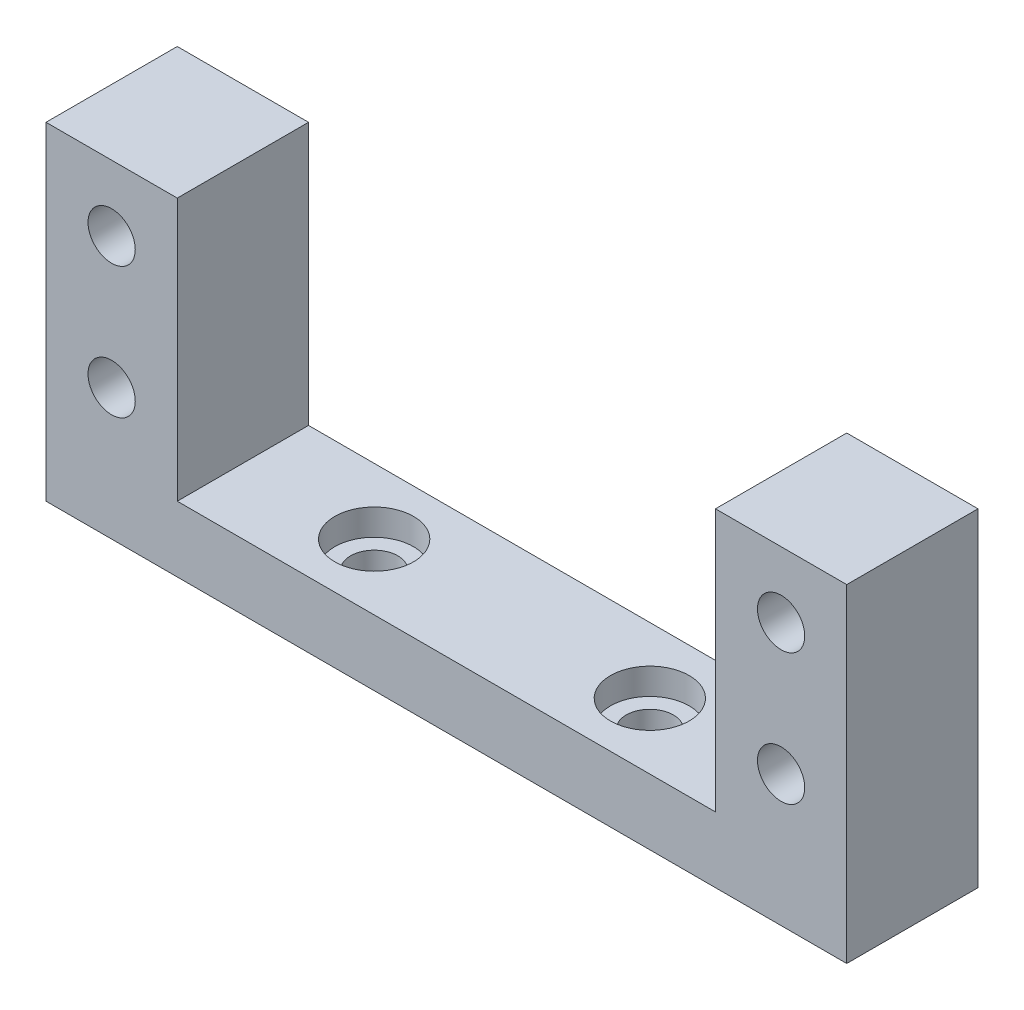
from build123d import *

# Parameters (mm, degrees)
ESQUISSE1_R             = 1.8
BOSS_EXTRU_1_DEPTH      = 10
ESQUISSE2_R             = 1.8
ENL_V_MAT_EXTRU_1_DEPTH = 10
ESQUISSE3_R             = 3
ENL_V_MAT_EXTRU_2_DEPTH = 2


with BuildPart() as part:
    # Esquisse1 → Boss.-Extru.1 (new body)
    with BuildSketch(Plane.XY):
        Polygon((0, 25), (-10, 25), (-10, 0), (51, 0), (51, 25), (41, 25), (41, 5), (0, 5), align=None)
        with Locations((-5, 10)):
            Circle(ESQUISSE1_R, mode=Mode.SUBTRACT)
        with Locations((-5, 20)):
            Circle(ESQUISSE1_R, mode=Mode.SUBTRACT)
        with Locations((46, 20)):
            Circle(ESQUISSE1_R, mode=Mode.SUBTRACT)
        with Locations((46, 10)):
            Circle(ESQUISSE1_R, mode=Mode.SUBTRACT)
    extrude(amount=BOSS_EXTRU_1_DEPTH)

    # Esquisse2 → Enlèv. mat.-Extru.1 (cut)
    with BuildSketch(Plane.XZ):
        with Locations((10, 5)):
            Circle(ESQUISSE2_R)
        with Locations((31, 5)):
            Circle(ESQUISSE2_R)
    extrude(amount=-ENL_V_MAT_EXTRU_1_DEPTH, mode=Mode.SUBTRACT)

    # Esquisse3 → Enlèv. mat.-Extru.2 (cut)
    with BuildSketch(Plane(origin=(0, 5, 0), x_dir=(1, 0, 0), z_dir=(0, 1, 0))):
        with Locations((10, -5)):
            Circle(ESQUISSE3_R)
        with Locations((31, -5)):
            Circle(ESQUISSE3_R)
    extrude(amount=-ENL_V_MAT_EXTRU_2_DEPTH, mode=Mode.SUBTRACT)


solid = part.part
